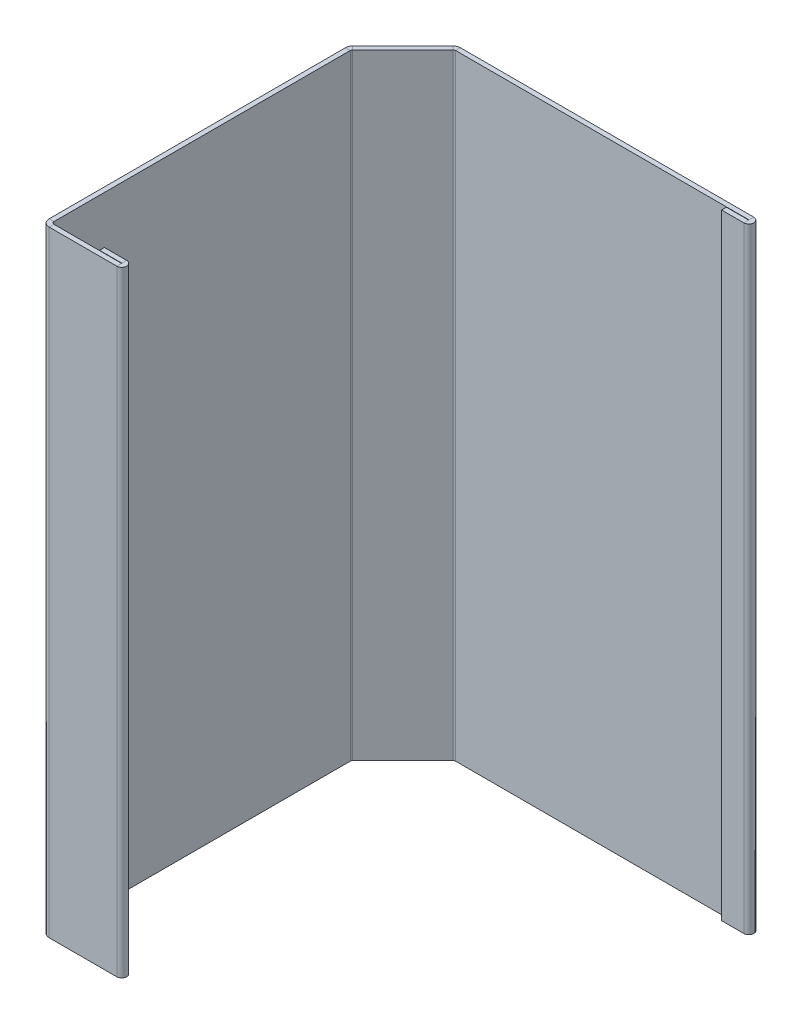
from build123d import *

# Parameters (mm, degrees)
BASE_FLANGE1_DEPTH = 96
HEM1_START         = -96
HEM1_DEPTH         = 192
HEM1_2_DEPTH       = 192


# Read off the part's stored shape, not the designer's step: Hem1
# Sheet-metal steps are written as plain solids
with BuildPart() as part:
    # Sketch1 → Base-Flange1 (new, symmetric)
    with BuildSketch(Plane(origin=(0, 0, 0), x_dir=(-1, 0, 0), z_dir=(0, 1, 0))):
        with BuildLine():
            Line((0, 0), (93.073569946, 0))
            ThreePointArc((93.073569946, 0), (93.929479711, 0.170251038), (94.655084973, 0.655084973))
            Line((94.655084973, 0.655084973), (110.344915027, 16.344915027))
            ThreePointArc((110.344915027, 16.344915027), (110.829748962, 17.070520289), (111, 17.926430054))
            Line((111, 17.926430054), (111, 110.3634))
            ThreePointArc((111, 110.3634), (110.344915027, 111.944915027), (108.7634, 112.6))
            Line((108.7634, 112.6), (86.118343195, 112.6))
            Line((86.118343195, 112.6), (86.118343195, 111.1))
            Line((86.118343195, 111.1), (108.7634, 111.1))
            ThreePointArc((108.7634, 111.1), (109.284254855, 110.884254855), (109.5, 110.3634))
            Line((109.5, 110.3634), (109.5, 17.926430054))
            ThreePointArc((109.5, 17.926430054), (109.443929664, 17.644545437), (109.284254855, 17.405575199))
            Line((109.284254855, 17.405575199), (93.594424801, 1.715745145))
            ThreePointArc((93.594424801, 1.715745145), (93.355454563, 1.556070336), (93.073569946, 1.5))
            Line((93.073569946, 1.5), (0, 1.5))
            Line((0, 1.5), (0, 0))
        make_face()
    extrude(amount=BASE_FLANGE1_DEPTH, both=True)

    # Hem1 outline → Hem1 (cut)
    with BuildSketch(Plane(origin=(0, 0, 0), x_dir=(1, 0, 0), z_dir=(0, 1, 0)).offset(HEM1_START)):
        with BuildLine():
            Line((-86.118343195, -111.1), (-86.119149857, -111.1))
            ThreePointArc((-86.119149857, -111.1), (-86.590150262, -112.163552873), (-87.668343195, -112.6))
            Line((-87.668343195, -112.6), (-86.118343195, -112.6))
            Line((-86.118343195, -112.6), (-86.118343195, -111.1))
        make_face()
        with BuildLine():
            ThreePointArc((-1.55, 0), (-0.471807067, -0.436447127), (-0.000806662, -1.5))
            Line((-0.000806662, -1.5), (0, -1.5))
            Line((0, -1.5), (0, 0))
            Line((0, 0), (-1.55, 0))
        make_face()
    extrude(amount=HEM1_DEPTH, mode=Mode.SUBTRACT)

    # Hem1 2 outline → Hem1 2 (add)
    with BuildSketch(Plane(origin=(0, 0, 0), x_dir=(1, 0, 0), z_dir=(0, 1, 0)).offset(HEM1_START)):
        with BuildLine():
            Line((-94.618343195, -109.5), (-94.618343195, -111))
            Line((-94.618343195, -111), (-87.668343195, -111))
            ThreePointArc((-87.668343195, -111), (-87.618343195, -111.05), (-87.668343195, -111.1))
            Line((-87.668343195, -111.1), (-86.119149857, -111.1))
            ThreePointArc((-86.119149857, -111.1), (-86.554790322, -109.971807067), (-87.668343195, -109.5))
            Line((-87.668343195, -109.5), (-94.618343195, -109.5))
        make_face()
        with BuildLine():
            Line((-8.5, -1.6), (-8.5, -3.1))
            Line((-8.5, -3.1), (-1.55, -3.1))
            ThreePointArc((-1.55, -3.1), (-0.436447127, -2.628192933), (-0.000806662, -1.5))
            Line((-0.000806662, -1.5), (-1.55, -1.5))
            ThreePointArc((-1.55, -1.5), (-1.5, -1.55), (-1.55, -1.6))
            Line((-1.55, -1.6), (-8.5, -1.6))
        make_face()
    extrude(amount=HEM1_2_DEPTH)


solid = part.part
